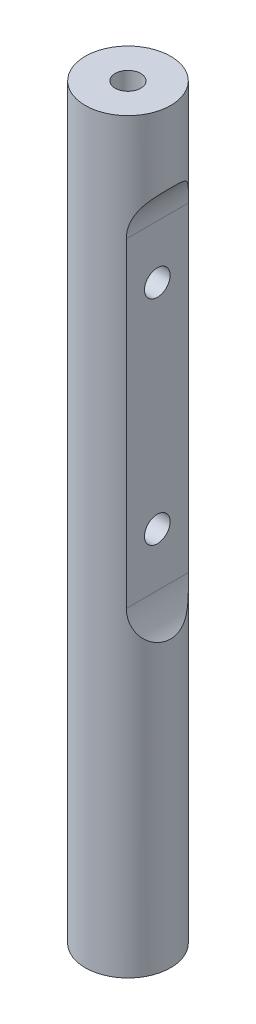
from build123d import *

# Parameters (mm, degrees)
SKETCH1_R                            = 5.08
BOSS_EXTRUDE1_DEPTH                  = 88.9
TAPPED_HOLE_FOR_4_40_HELICOIL1_D     = 3.048
TAPPED_HOLE_FOR_4_40_HELICOIL1_DEPTH = 8.128
TAPPED_HOLE_FOR_4_40_HELICOIL1_TIP   = 0.915711583
TAPPED_HOLE_FOR_4_40_HELICOIL2_D     = 3.048
TAPPED_HOLE_FOR_4_40_HELICOIL2_DEPTH = 8.128
TAPPED_HOLE_FOR_4_40_HELICOIL2_TIP   = 0.915711583
CUT_EXTRUDE1_DEPTH                   = 90.18981332
CUT_EXTRUDE1_DEPTH_BACK              = 90.18981332
TAPPED_HOLE_FOR_4_40_HELICOIL3_D     = 3.048


with BuildPart() as part:
    # Sketch1 → Boss-Extrude1 (new body)
    with BuildSketch(Plane(origin=(0, 0, 0), x_dir=(1, 0, 0), z_dir=(0, 1, 0))):
        Circle(SKETCH1_R)
    extrude(amount=BOSS_EXTRUDE1_DEPTH)

    # Tapped Hole for #4-40 Helicoil1
    with Locations(Plane(origin=(0, 88.9, 0), x_dir=(1, 0, 0), z_dir=(0, 1, 0))):
        with Locations((0, 0)):
            Hole(TAPPED_HOLE_FOR_4_40_HELICOIL1_D / 2, depth=TAPPED_HOLE_FOR_4_40_HELICOIL1_DEPTH)
            with Locations((0, 0, -(TAPPED_HOLE_FOR_4_40_HELICOIL1_DEPTH + TAPPED_HOLE_FOR_4_40_HELICOIL1_TIP / 2))):  # 118° drill point
                Cone(0, TAPPED_HOLE_FOR_4_40_HELICOIL1_D / 2, TAPPED_HOLE_FOR_4_40_HELICOIL1_TIP, mode=Mode.SUBTRACT)

    # Tapped Hole for #4-40 Helicoil2
    with Locations(Plane(origin=(0, 0, 0), x_dir=(-1, 0, 0), z_dir=(0, -1, 0))):
        with Locations((0, 0)):
            Hole(TAPPED_HOLE_FOR_4_40_HELICOIL2_D / 2, depth=TAPPED_HOLE_FOR_4_40_HELICOIL2_DEPTH)
            with Locations((0, 0, -(TAPPED_HOLE_FOR_4_40_HELICOIL2_DEPTH + TAPPED_HOLE_FOR_4_40_HELICOIL2_TIP / 2))):  # 118° drill point
                Cone(0, TAPPED_HOLE_FOR_4_40_HELICOIL2_D / 2, TAPPED_HOLE_FOR_4_40_HELICOIL2_TIP, mode=Mode.SUBTRACT)

    # Sketch8 → Cut-Extrude1 (cut, two sides: drawn at the far end of the back side and taken through both)
    with BuildSketch(Plane.XY.offset(-CUT_EXTRUDE1_DEPTH_BACK)):
        with BuildLine():
            ThreePointArc((5.08, 80.400130206), (3.902618898, 78.44506403), (3.4925, 76.2))
            Line((3.4925, 76.2), (3.4925, 38.1))
            ThreePointArc((3.4925, 38.1), (3.902618898, 35.85493597), (5.08, 33.899869794))
            Line((5.08, 33.899869794), (5.08, 80.400130206))
        make_face()
    extrude(amount=CUT_EXTRUDE1_DEPTH + CUT_EXTRUDE1_DEPTH_BACK, mode=Mode.SUBTRACT)

    # Tapped Hole for #4-40 Helicoil3 (through all)
    with Locations(Plane(origin=(3.4925, 0, 0), x_dir=(0, 0, -1), z_dir=(1, 0, 0))):
        with Locations((0, 69.85), (0, 44.45)):
            Hole(TAPPED_HOLE_FOR_4_40_HELICOIL3_D / 2)


solid = part.part
